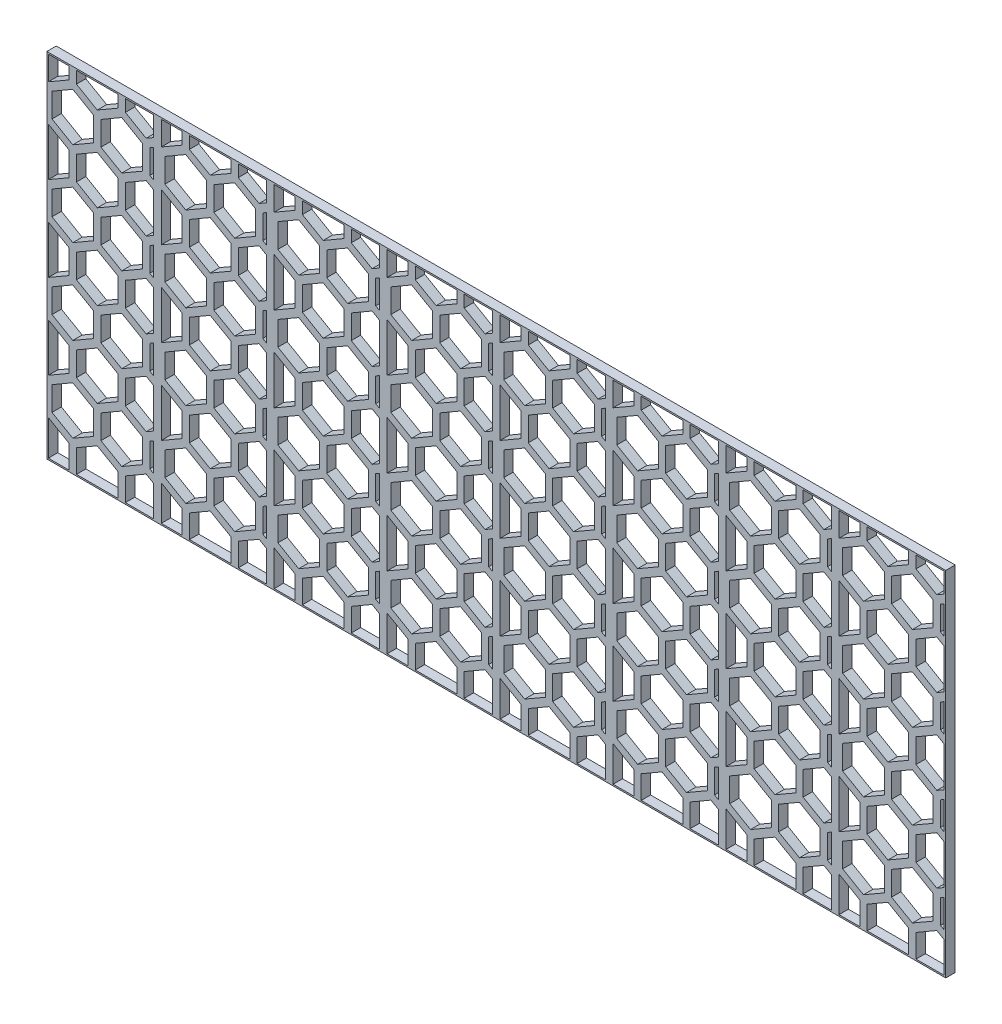
from build123d import *

# Parameters (mm, degrees)
BOSS_EXTRUDE1_DEPTH = 6.35
SKETCH2_W           = 76.2
SKETCH2_H           = 238.125
SKETCH2_W_2         = 70.993
SKETCH2_H_2         = 236.093
BOSS_EXTRUDE3_DEPTH = 6.35
LPATTERN1_COUNT     = 8
LPATTERN1_PITCH     = 76.2
SKETCH5_W           = 6.35
SKETCH5_H           = 238.125
CUT_EXTRUDE1_DEPTH  = 1.5875
SKETCH6_W           = 6.35
SKETCH6_H           = 238.125
CUT_EXTRUDE2_DEPTH  = 1.5875


# Read off the part's stored shape, not the designer's step: Boss-Extrude1
with BuildPart() as part:
    # Boss-Extrude1 outline → Boss-Extrude1 (new body)
    with BuildSketch(Plane.XY):
        Polygon((68.45541971, 215.620245003), (70.993, 217.085317666), (70.993, 222.776337655), (65.991135768, 219.888509995), (51.957635768, 227.990754997), (51.957635768, 236.093), (47.029067884, 236.093), (47.029067884, 227.990754997), (32.995567884, 219.888509995), (18.962067884, 227.990754997), (18.962067884, 236.093), (14.0335, 236.093), (14.0335, 227.990754997), (0, 219.888509995), (0, 195.147490005), (14.0335, 187.045245003), (14.0335, 170.840754997), (0, 162.738509995), (0, 137.997490005), (14.0335, 129.895245003), (14.0335, 113.690754997), (0, 105.588509995), (0, 80.847490005), (14.0335, 72.745245003), (14.0335, 56.540754997), (0, 48.438509995), (0, 23.697490005), (14.0335, 15.595245003), (14.0335, 0), (18.962067884, 0), (18.962067884, 15.595245003), (32.995567884, 23.697490005), (47.029067884, 15.595245003), (47.029067884, 0), (51.957635768, 0), (51.957635768, 15.595245003), (65.991135768, 23.697490005), (70.993, 20.809662345), (70.993, 26.500682334), (68.45541971, 27.965754997), (68.45541971, 44.170245003), (70.993, 45.635317666), (70.993, 51.326337655), (65.991135768, 48.438509995), (51.957635768, 56.540754997), (51.957635768, 72.745245003), (65.991135768, 80.847490005), (70.993, 77.959662345), (70.993, 83.650682334), (68.45541971, 85.115754997), (68.45541971, 101.320245003), (70.993, 102.785317666), (70.993, 108.476337655), (65.991135768, 105.588509995), (51.957635768, 113.690754997), (51.957635768, 129.895245003), (65.991135768, 137.997490005), (70.993, 135.109662345), (70.993, 140.800682334), (68.45541971, 142.265754997), (68.45541971, 158.470245003), (70.993, 159.935317666), (70.993, 165.626337655), (65.991135768, 162.738509995), (51.957635768, 170.840754997), (51.957635768, 187.045245003), (65.991135768, 195.147490005), (70.993, 192.259662345), (70.993, 197.950682334), (68.45541971, 199.415754997), align=None)
        Polygon((16.497783942, 52.272490005), (30.531283942, 44.170245003), (30.531283942, 27.965754997), (16.497783942, 19.863509995), (2.464283942, 27.965754997), (2.464283942, 44.170245003), align=None, mode=Mode.SUBTRACT)
        Polygon((16.497783942, 109.422490005), (30.531283942, 101.320245003), (30.531283942, 85.115754997), (16.497783942, 77.013509995), (2.464283942, 85.115754997), (2.464283942, 101.320245003), align=None, mode=Mode.SUBTRACT)
        Polygon((32.995567884, 80.847490005), (47.029067884, 72.745245003), (47.029067884, 56.540754997), (32.995567884, 48.438509995), (18.962067884, 56.540754997), (18.962067884, 72.745245003), align=None, mode=Mode.SUBTRACT)
        Polygon((49.493351826, 52.272490005), (63.526851826, 44.170245003), (63.526851826, 27.965754997), (49.493351826, 19.863509995), (35.459851826, 27.965754997), (35.459851826, 44.170245003), align=None, mode=Mode.SUBTRACT)
        Polygon((49.493351826, 109.422490005), (63.526851826, 101.320245003), (63.526851826, 85.115754997), (49.493351826, 77.013509995), (35.459851826, 85.115754997), (35.459851826, 101.320245003), align=None, mode=Mode.SUBTRACT)
        Polygon((16.497783942, 166.572490005), (30.531283942, 158.470245003), (30.531283942, 142.265754997), (16.497783942, 134.163509995), (2.464283942, 142.265754997), (2.464283942, 158.470245003), align=None, mode=Mode.SUBTRACT)
        Polygon((32.995567884, 137.997490005), (47.029067884, 129.895245003), (47.029067884, 113.690754997), (32.995567884, 105.588509995), (18.962067884, 113.690754997), (18.962067884, 129.895245003), align=None, mode=Mode.SUBTRACT)
        Polygon((16.497783942, 223.722490005), (30.531283942, 215.620245003), (30.531283942, 199.415754997), (16.497783942, 191.313509995), (2.464283942, 199.415754997), (2.464283942, 215.620245003), align=None, mode=Mode.SUBTRACT)
        Polygon((32.995567884, 195.147490005), (47.029067884, 187.045245003), (47.029067884, 170.840754997), (32.995567884, 162.738509995), (18.962067884, 170.840754997), (18.962067884, 187.045245003), align=None, mode=Mode.SUBTRACT)
        Polygon((49.493351826, 166.572490005), (63.526851826, 158.470245003), (63.526851826, 142.265754997), (49.493351826, 134.163509995), (35.459851826, 142.265754997), (35.459851826, 158.470245003), align=None, mode=Mode.SUBTRACT)
        Polygon((49.493351826, 223.722490005), (63.526851826, 215.620245003), (63.526851826, 199.415754997), (49.493351826, 191.313509995), (35.459851826, 199.415754997), (35.459851826, 215.620245003), align=None, mode=Mode.SUBTRACT)
    extrude(amount=BOSS_EXTRUDE1_DEPTH)

    # Sketch2 → Boss-Extrude3 (add)
    with BuildSketch(Plane.XY):
        with Locations((35.4965, 118.0465)):
            Rectangle(SKETCH2_W, SKETCH2_H)
        with Locations((35.4965, 118.0465)):
            Rectangle(SKETCH2_W_2, SKETCH2_H_2, mode=Mode.SUBTRACT)
    extrude(amount=BOSS_EXTRUDE3_DEPTH)


with BuildPart() as lpattern1_1:
    # LPattern1: pattern copy
    add(part.part.moved(Location(Vector(1, 0, 0) * (1 * LPATTERN1_PITCH))))


with BuildPart() as lpattern1_2:
    # LPattern1: pattern copy
    add(part.part.moved(Location(Vector(1, 0, 0) * (2 * LPATTERN1_PITCH))))


with BuildPart() as lpattern1_3:
    # LPattern1: pattern copy
    add(part.part.moved(Location(Vector(1, 0, 0) * (3 * LPATTERN1_PITCH))))


with BuildPart() as lpattern1_4:
    # LPattern1: pattern copy
    add(part.part.moved(Location(Vector(1, 0, 0) * (4 * LPATTERN1_PITCH))))


with BuildPart() as lpattern1_5:
    # LPattern1: pattern copy
    add(part.part.moved(Location(Vector(1, 0, 0) * (5 * LPATTERN1_PITCH))))


with BuildPart() as lpattern1_6:
    # LPattern1: pattern copy
    add(part.part.moved(Location(Vector(1, 0, 0) * (6 * LPATTERN1_PITCH))))


with BuildPart() as lpattern1_7:
    # LPattern1: pattern copy
    add(part.part.moved(Location(Vector(1, 0, 0) * (7 * LPATTERN1_PITCH))))

    # Sketch6 → Cut-Extrude2 (cut)
    with BuildSketch(Plane(origin=(606.9965, 0, 0), x_dir=(0, 0, -1), z_dir=(1, 0, 0))):
        with Locations((-3.175, 118.0465)):
            Rectangle(SKETCH6_W, SKETCH6_H)
    extrude(amount=-CUT_EXTRUDE2_DEPTH, mode=Mode.SUBTRACT)


with BuildPart() as part_1:
    add(part.part)

    # Sketch5 → Cut-Extrude1 (cut)
    with BuildSketch(Plane.ZY.offset(2.6035)):
        with Locations((3.175, 118.0465)):
            Rectangle(SKETCH5_W, SKETCH5_H)
    extrude(amount=-CUT_EXTRUDE1_DEPTH, mode=Mode.SUBTRACT)


with BuildPart() as lpattern1_5_1:
    add(lpattern1_5.part)

    # Combine1: union LPattern1_7, LPattern1_2, LPattern1_4, LPattern1_6, LPattern1_1, part, LPattern1_3
    add(lpattern1_7.part)
    add(lpattern1_2.part)
    add(lpattern1_4.part)
    add(lpattern1_6.part)
    add(lpattern1_1.part)
    add(part_1.part)
    add(lpattern1_3.part)


solid = lpattern1_5_1.part
